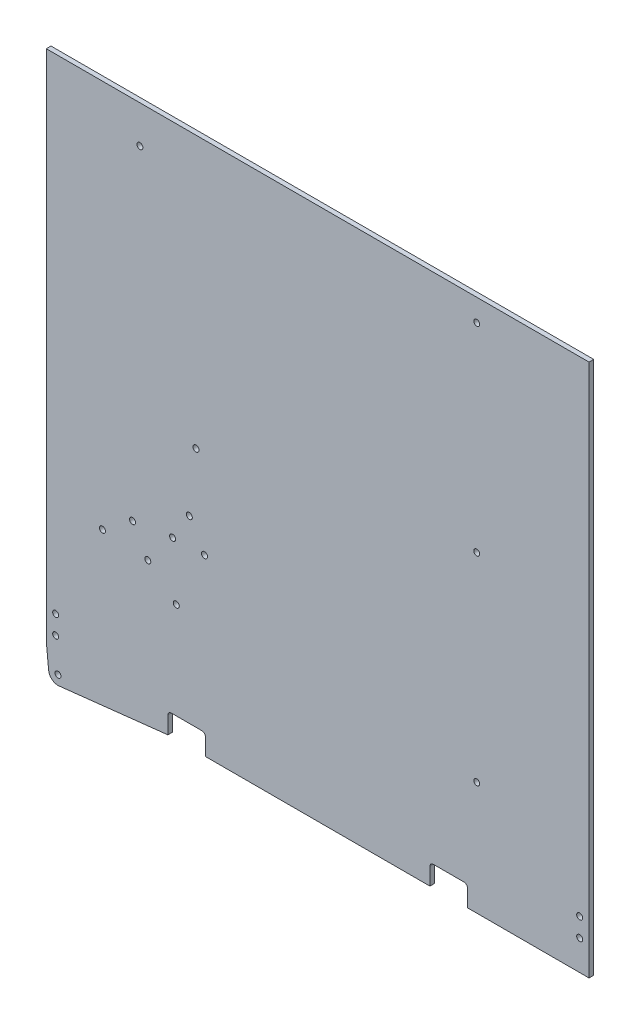
from build123d import *

# Parameters (mm, degrees)
SKETCH1_R           = 2.032
SKETCH1_R_2         = 2
BOSS_EXTRUDE1_DEPTH = 3.175
FILLET1_R           = 2.286


with BuildPart() as part:
    # Sketch1 → Boss-Extrude1 (new body)
    with BuildSketch(Plane.XY):
        with BuildLine():
            Line((82.55, -20.32), (82.55, -6.35))
            Line((82.55, -6.35), (107.95, -6.35))
            Line((107.95, -6.35), (107.95, -20.32))
            Line((107.95, -20.32), (260.35, -20.32))
            Line((260.35, -20.32), (260.35, -6.35))
            Line((260.35, -6.35), (285.75, -6.35))
            Line((285.75, -6.35), (285.75, -20.32))
            Line((285.75, -20.32), (368.3, -20.32))
            Line((368.3, -20.32), (368.3, 341.63))
            Line((368.3, 341.63), (0, 341.63))
            Line((0, 341.63), (0, 0))
            Line((0, 0), (0, -6.35))
            ThreePointArc((0, -6.35), (0.007883354, -6.666317007), (0.031513842, -6.981848616))
            Line((0.031513842, -6.981848616), (1.619013842, -22.856848616))
            ThreePointArc((1.619013842, -22.856848616), (3.943628298, -27.161748811), (8.639060666, -28.536126099))
            Line((8.639060666, -28.536126099), (82.55, -20.32))
        make_face()
        with Locations((6.35, 0)):
            Circle(SKETCH1_R, mode=Mode.SUBTRACT)
        with Locations((6.35, 12.7)):
            Circle(SKETCH1_R, mode=Mode.SUBTRACT)
        with Locations((361.95, 0)):
            Circle(SKETCH1_R, mode=Mode.SUBTRACT)
        with Locations((361.95, 12.7)):
            Circle(SKETCH1_R, mode=Mode.SUBTRACT)
        with Locations((7.9375, -22.225)):
            Circle(SKETCH1_R, mode=Mode.SUBTRACT)
        with Locations((38.1, 78.105)):
            Circle(SKETCH1_R, mode=Mode.SUBTRACT)
        with Locations((85.725, 97.155)):
            Circle(SKETCH1_R, mode=Mode.SUBTRACT)
        with Locations((58.568579744, 93.391299635)):
            Circle(SKETCH1_R, mode=Mode.SUBTRACT)
        with Locations((68.887329744, 75.518700365)):
            Circle(SKETCH1_R, mode=Mode.SUBTRACT)
        with Locations((107.382158942, 97.743700365)):
            Circle(SKETCH1_R, mode=Mode.SUBTRACT)
        with Locations((97.063408942, 115.616299635)):
            Circle(SKETCH1_R, mode=Mode.SUBTRACT)
        with Locations((88.216909404, 59.136578314)):
            Circle(SKETCH1_R, mode=Mode.SUBTRACT)
        with Locations((292.1, 56.63)):
            Circle(SKETCH1_R_2, mode=Mode.SUBTRACT)
        with Locations((292.1, 191.63)):
            Circle(SKETCH1_R_2, mode=Mode.SUBTRACT)
        with Locations((292.1, 326.63)):
            Circle(SKETCH1_R_2, mode=Mode.SUBTRACT)
        with Locations((63.5, 316.23)):
            Circle(SKETCH1_R, mode=Mode.SUBTRACT)
        with Locations((101.6, 157.48)):
            Circle(SKETCH1_R, mode=Mode.SUBTRACT)
    extrude(amount=BOSS_EXTRUDE1_DEPTH)

    # Fillet1
    fillet1_edges = [part.edges().sort_by_distance(p)[0] for p in [
        (285.75, -6.35, 1.5875),
        (107.95, -6.35, 1.5875),
        (260.35, -6.35, 1.5875),
        (82.55, -6.35, 1.5875),
    ]]
    fillet(fillet1_edges, radius=FILLET1_R)


solid = part.part
